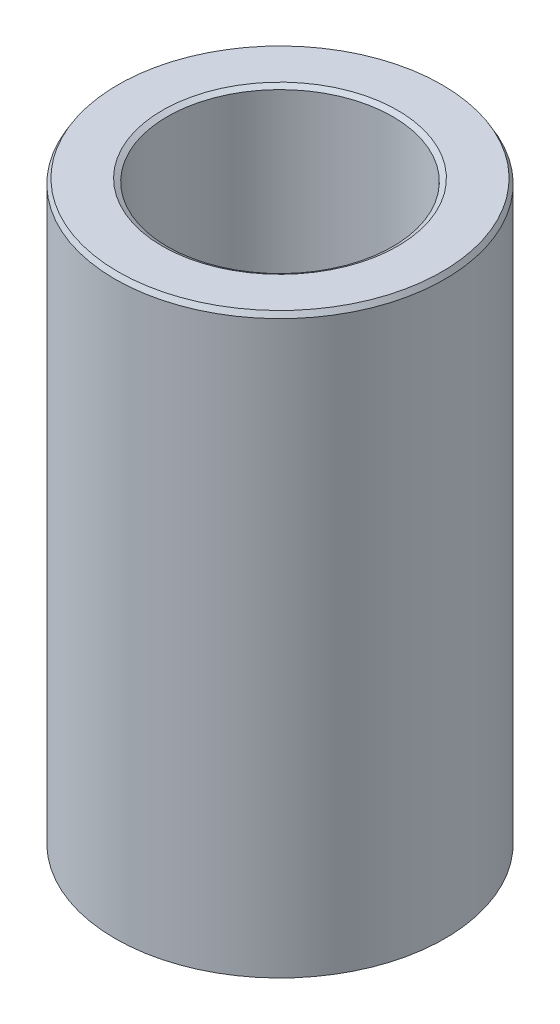
from build123d import *
from OCP.BRepFilletAPI import BRepFilletAPI_MakeChamfer

# Parameters (mm, degrees)
SKETCH1_R           = 15
BOSS_EXTRUDE1_DEPTH = 52.665064251
SKETCH2_R           = 10.250330775
CUT_EXTRUDE1_DEPTH  = 57.776834999
CHAMFER1_SIZE       = 0.456486046
CHAMFER1_SIZE2      = 0.263552341


with BuildPart() as part:
    # Sketch1 → Boss-Extrude1 (new body)
    with BuildSketch(Plane(origin=(0, 0, 0), x_dir=(1, 0, 0), z_dir=(0, 1, 0))):
        Circle(SKETCH1_R)
    extrude(amount=BOSS_EXTRUDE1_DEPTH)

    # Sketch2 → Cut-Extrude1 (cut, through all)
    with BuildSketch(Plane(origin=(0, 0, 0), x_dir=(1, 0, 0), z_dir=(0, 1, 0))):
        Circle(SKETCH2_R)
    extrude(amount=CUT_EXTRUDE1_DEPTH, mode=Mode.SUBTRACT)

    # Chamfer1: one chamfer whose edges measure the first distance from different faces: ONE call of the kernel's chamfer builder (chamfer() names one face for all edges)
    chamfer1_edges_1 = [part.edges().sort_by_distance(p)[0] for p in [
        (-10.250330775, 52.665064251, 0),
    ]]
    chamfer1_side_1 = [part.faces().sort_by_distance(p)[0] for p in [
        (-14.575735931, 52.665064251, 0),
    ]]
    chamfer1_edges_2 = [part.edges().sort_by_distance(p)[0] for p in [
        (-10.250330775, 0, 0),
    ]]
    chamfer1_side_2 = [part.faces().sort_by_distance(p)[0] for p in [
        (-10.250330775, 26.332532125, 0),
    ]]
    chamfer1_edges_3 = [part.edges().sort_by_distance(p)[0] for p in [
        (-15, 0, 0),
    ]]
    chamfer1_side_3 = [part.faces().sort_by_distance(p)[0] for p in [
        (-14.575735931, 0, 0),
    ]]
    chamfer1_edges_4 = [part.edges().sort_by_distance(p)[0] for p in [
        (-15, 52.665064251, 0),
    ]]
    chamfer1_side_4 = [part.faces().sort_by_distance(p)[0] for p in [
        (-15, 26.332532125, 0),
    ]]
    chamfer1 = BRepFilletAPI_MakeChamfer(part.part.solid().wrapped)
    for e in chamfer1_edges_1:
        chamfer1.Add(CHAMFER1_SIZE, CHAMFER1_SIZE2, e.wrapped, chamfer1_side_1[0].wrapped)  # the first distance lies on this face
    for e in chamfer1_edges_2:
        chamfer1.Add(CHAMFER1_SIZE, CHAMFER1_SIZE2, e.wrapped, chamfer1_side_2[0].wrapped)  # the first distance lies on this face
    for e in chamfer1_edges_3:
        chamfer1.Add(CHAMFER1_SIZE, CHAMFER1_SIZE2, e.wrapped, chamfer1_side_3[0].wrapped)  # the first distance lies on this face
    for e in chamfer1_edges_4:
        chamfer1.Add(CHAMFER1_SIZE, CHAMFER1_SIZE2, e.wrapped, chamfer1_side_4[0].wrapped)  # the first distance lies on this face
    add(Compound.cast(chamfer1.Shape()), mode=Mode.REPLACE)


solid = part.part
